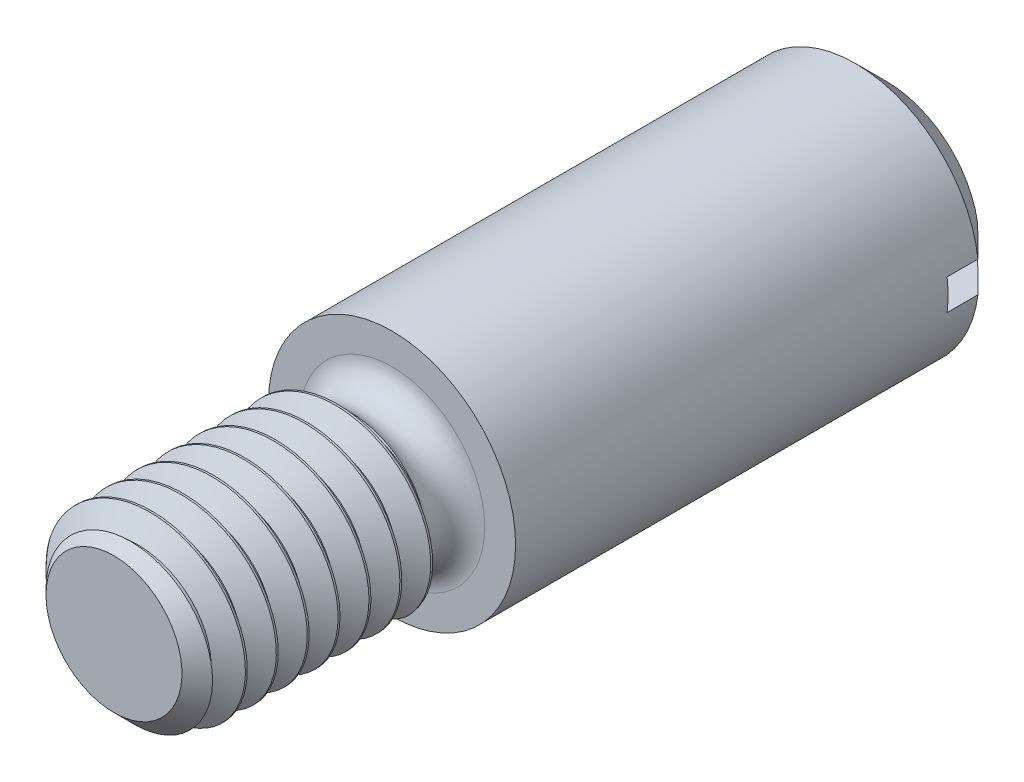
from build123d import *

# Parameters (mm, degrees)
SKETCH2_W          = 4
SKETCH2_H          = 0.5
CUT_EXTRUDE1_DEPTH = 1
CUT_SWEEP3_PITCH   = 0.5


with BuildPart() as part:
    # Sketch1 → Revolve1 (revolve)
    with BuildSketch(Plane(origin=(0, 0, 0), x_dir=(0, 0, -1), z_dir=(1, 0, 0)), mode=Mode.PRIVATE) as revolve1_sk:
        with BuildLine():
            Line((-6.25, 0), (-6.25, 1.1))
            Line((-6.25, 1.1), (-5.85, 1.5))
            Line((-5.85, 1.5), (-2.561898816, 1.5))
            ThreePointArc((-2.561898816, 1.5), (-2.155949408, 1.094050592), (-1.75, 1.5))
            Line((-1.75, 1.5), (-1.75, 2))
            Line((-1.75, 2), (5.75, 2))
            Line((5.75, 2), (6.25, 1.5))
            Line((6.25, 1.5), (6.25, 0))
            Line((6.25, 0), (-6.25, 0))
        make_face()
    revolve(revolve1_sk.sketch.rotate(Axis((0, 0, -6.25), (0, 0, 1)), 90), axis=Axis((0, 0, -6.25), (0, 0, 1)))

    # Sketch2 → Cut-Extrude1 (cut)
    with BuildSketch(Plane(origin=(0, 0, -6.25), x_dir=(-1, 0, 0), z_dir=(0, 0, -1))):
        Rectangle(SKETCH2_W, SKETCH2_H)
    extrude(amount=-CUT_EXTRUDE1_DEPTH, mode=Mode.SUBTRACT)

    # Cut-Sweep3: the profile of Sketch4 profile screwed along a right-hand helix of 8.5 turns, 6 arcs to a turn; built about Z, then put on its axis
    cut_sweep3_z = Axis((0, 0, 0), (0, 0, 1))
    cut_sweep3_corners = [(1.14817718, 0, -0.265625), (1.14817718, 0, -0.203125), (1.5003, 0, 0.000173205), (1.5003, 0, -0.468923205)]
    with BuildLine(mode=Mode.PRIVATE) as cut_sweep3_profile:
        Line(cut_sweep3_corners[0], cut_sweep3_corners[1])
        Line(cut_sweep3_corners[1], cut_sweep3_corners[2])
        Line(cut_sweep3_corners[2], cut_sweep3_corners[3])
        Line(cut_sweep3_corners[3], cut_sweep3_corners[0])
    cut_sweep3_cap = Face(cut_sweep3_profile.wire())
    cut_sweep3_turn_angles = [0, 30, 60, 90, 120, 150, 180, 210, 240, 270, 300, 330, 360]
    cut_sweep3_turn_weights = [1, 0.8660254037844387, 1, 0.8660254037844387, 1, 0.8660254037844387, 1, 0.8660254037844387, 1, 0.8660254037844387, 1, 0.8660254037844387, 1]
    cut_sweep3_turn_rails = [Edge.make_bspline([Vector(p[0], p[1], 0).rotate(cut_sweep3_z, cut_sweep3_turn_angles[k]) / cut_sweep3_turn_weights[k] + Vector(0, 0, p[2] + CUT_SWEEP3_PITCH * cut_sweep3_turn_angles[k] / 360) for k in range(13)], [0, 0, 0, 1, 1, 2, 2, 3, 3, 4, 4, 5, 5, 6, 6, 6], 2, cut_sweep3_turn_weights) for p in cut_sweep3_corners]
    cut_sweep3_turn_sides = [Face.make_surface_from_curves(cut_sweep3_turn_rails[p[0]], cut_sweep3_turn_rails[p[1]]) for p in [(0, 1), (1, 2), (2, 3), (3, 0)]]
    cut_sweep3_last_angles = [2880, 2910, 2940, 2970, 3000, 3030, 3060]
    cut_sweep3_last_weights = [1, 0.8660254037844387, 1, 0.8660254037844387, 1, 0.8660254037844426, 1]
    cut_sweep3_last_rails = [Edge.make_bspline([Vector(p[0], p[1], 0).rotate(cut_sweep3_z, cut_sweep3_last_angles[k]) / cut_sweep3_last_weights[k] + Vector(0, 0, p[2] + CUT_SWEEP3_PITCH * cut_sweep3_last_angles[k] / 360) for k in range(7)], [0, 0, 0, 1, 1, 2, 2, 3, 3, 3], 2, cut_sweep3_last_weights) for p in cut_sweep3_corners]
    cut_sweep3_last_sides = [Face.make_surface_from_curves(cut_sweep3_last_rails[p[0]], cut_sweep3_last_rails[p[1]]) for p in [(0, 1), (1, 2), (2, 3), (3, 0)]]
    cut_sweep3 = Plane(origin=(0, 0, 6.25), x_dir=(0, 1, 0), z_dir=(0, 0, -1)) * Solid(Shell([*[p.moved(Location((0, 0, CUT_SWEEP3_PITCH * i))) for i in range(8) for p in cut_sweep3_turn_sides], *cut_sweep3_last_sides, cut_sweep3_cap, cut_sweep3_cap.rotate(cut_sweep3_z, 3060).moved(Location((0, 0, CUT_SWEEP3_PITCH * 3060 / 360)))]))
    add(cut_sweep3, mode=Mode.SUBTRACT)


solid = part.part
